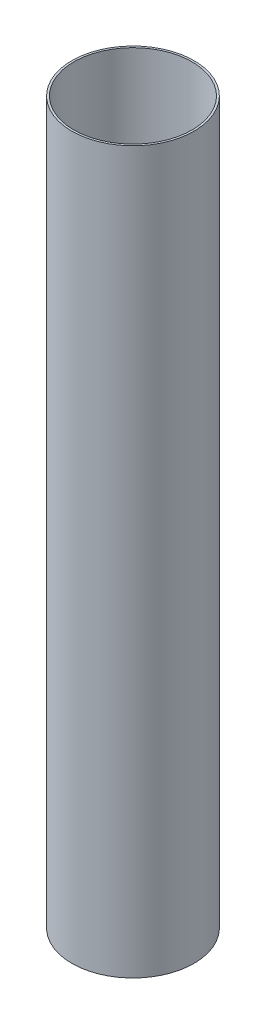
from build123d import *

# Parameters (mm, degrees)
ESQUISSE1_R        = 76.3
ESQUISSE1_R_2      = 73.8
BOSS_EXTRU_1_DEPTH = 900


with BuildPart() as part:
    # Esquisse1 → Boss.-Extru.1 (new body)
    with BuildSketch(Plane(origin=(0, 0, 0), x_dir=(1, 0, 0), z_dir=(0, 1, 0))):
        Circle(ESQUISSE1_R)
        Circle(ESQUISSE1_R_2, mode=Mode.SUBTRACT)
    extrude(amount=BOSS_EXTRU_1_DEPTH)


solid = part.part
